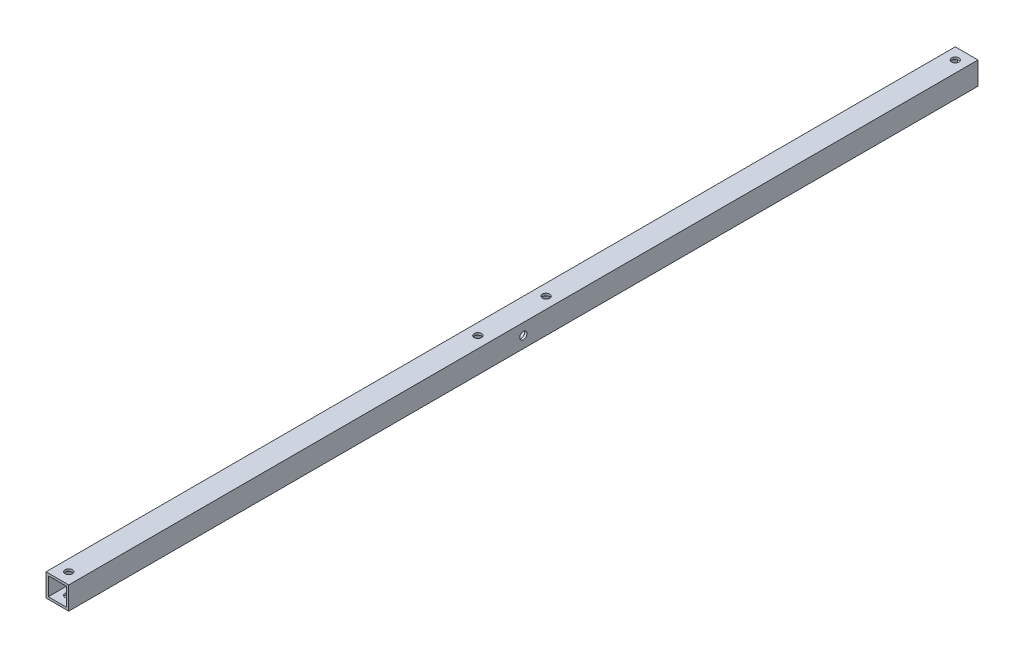
from build123d import *

# Parameters (mm, degrees)
SKETCH_1_W          = 10
SKETCH_1_H          = 10
SKETCH_1_W_2        = 8
SKETCH_1_H_2        = 8
EXTRUDE_1_DEPTH     = 399.7114317
SKETCH_2_R          = 1.6
CUT_EXTRUDE_1_DEPTH = 408.37168574
SKETCH_3_R          = 1.6
CUT_EXTRUDE_2_DEPTH = 10


with BuildPart() as part:
    # ｽｹｯﾁ1 → ﾎﾞｽ - 押し出し1 (new body)
    with BuildSketch(Plane.XY):
        Rectangle(SKETCH_1_W, SKETCH_1_H)
        Rectangle(SKETCH_1_W_2, SKETCH_1_H_2, mode=Mode.SUBTRACT)
    extrude(amount=EXTRUDE_1_DEPTH)

    # ｽｹｯﾁ2 → ｶｯﾄ - 押し出し1 (cut)
    with BuildSketch(Plane(origin=(0, 5, 0), x_dir=(1, 0, 0), z_dir=(0, 1, 0))):
        with Locations((0, -5)):
            Circle(SKETCH_2_R)
        with Locations((0, -394.7114317)):
            Circle(SKETCH_2_R)
        with Locations((0, -184.85571585)):
            Circle(SKETCH_2_R)
        with Locations((0, -214.85571585)):
            Circle(SKETCH_2_R)
    extrude(amount=-CUT_EXTRUDE_1_DEPTH, mode=Mode.SUBTRACT)

    # ｽｹｯﾁ3 → ｶｯﾄ - 押し出し2 (cut)
    with BuildSketch(Plane.ZY.offset(5)):
        with Locations((199.85571585, 0)):
            Circle(SKETCH_3_R)
    extrude(amount=-CUT_EXTRUDE_2_DEPTH, mode=Mode.SUBTRACT)


solid = part.part
